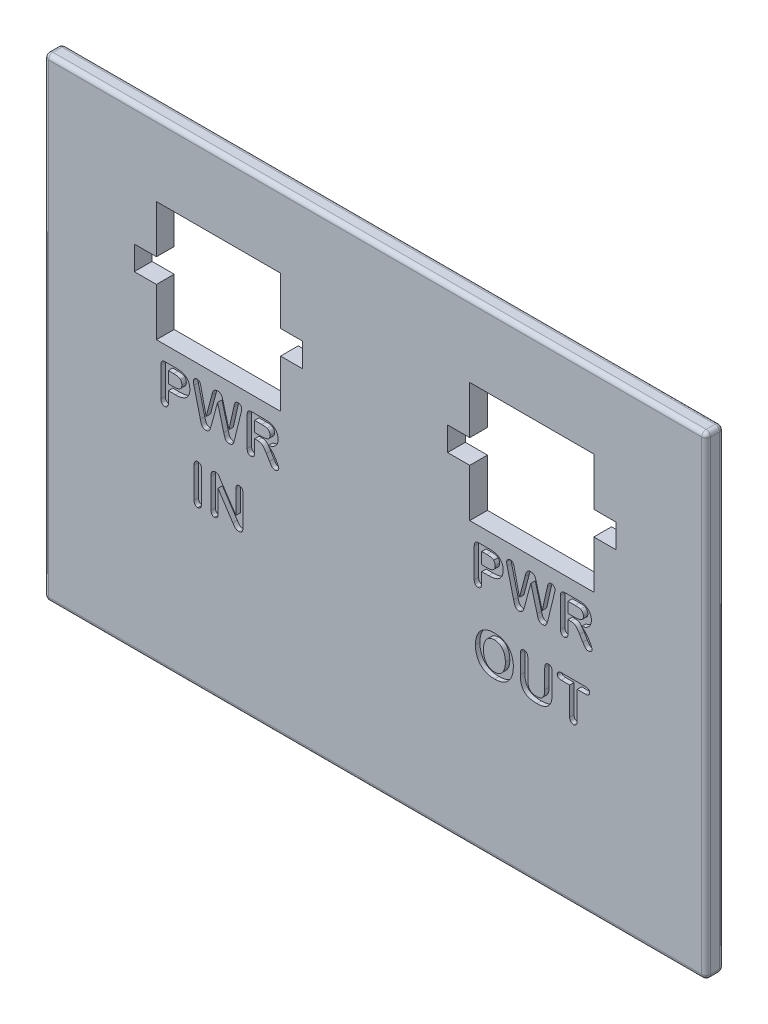
from build123d import *

# Parameters (mm, degrees)
SKETCH1_W           = 74.7
SKETCH1_H           = 53.5
BOSS_EXTRUDE1_DEPTH = 2
CUT_EXTRUDE1_DEPTH  = 46.984616993
FILLET1_R           = 0.5
CUT_EXTRUDE2_DEPTH  = 0.5


with BuildPart() as part:
    # Sketch1 → Boss-Extrude1 (new body)
    with BuildSketch(Plane.XY):
        Rectangle(SKETCH1_W, SKETCH1_H)
    extrude(amount=BOSS_EXTRUDE1_DEPTH)

    # Sketch5 → Cut-Extrude1 (cut, through all)
    with BuildSketch(Plane.XY.offset(2)):
        Polygon((24.675, 18.5), (10.675, 18.5), (10.675, 13.1), (8.175, 13.1), (8.175, 10.4), (10.675, 10.4), (10.675, 5), (24.675, 5), (24.675, 10.4), (27.175, 10.4), (27.175, 13.1), (24.675, 13.1), align=None)
        Polygon((-10.675, 18.5), (-24.675, 18.5), (-24.675, 13.1), (-27.175, 13.1), (-27.175, 10.4), (-24.675, 10.4), (-24.675, 5), (-10.675, 5), (-10.675, 10.4), (-8.175, 10.4), (-8.175, 13.1), (-10.675, 13.1), align=None)
    extrude(amount=-CUT_EXTRUDE1_DEPTH, mode=Mode.SUBTRACT)

    # Fillet1
    fillet1_edges = [part.edges().sort_by_distance(p)[0] for p in [
        (0, -26.75, 2),
        (0, -26.75, 0),
        (-37.35, 0, 2),
        (-37.35, -26.75, 1),
        (-37.35, 0, 0),
        (0, 26.75, 2),
        (-37.35, 26.75, 1),
        (0, 26.75, 0),
        (37.35, -26.75, 1),
        (37.35, 0, 2),
        (37.35, 26.75, 1),
        (37.35, 0, 0),
    ]]
    fillet(fillet1_edges, radius=FILLET1_R)

    # Sketch6 → Cut-Extrude2 (cut)
    # profile 1 of 11: a face of its own
    with BuildSketch(Plane.XY.offset(2)):
        with BuildLine():
            Line((-22.53046875, 0.6875), (-23.325, 0.6875))
            Line((-23.325, 0.6875), (-23.325, -0.526269531))
            add(Edge.make_bspline(
                [(-23.325, -0.526269531), (-23.326012223, -0.567125988), (-23.327931321, -0.644586786), (-23.35106835, -0.75263787), (-23.387497819, -0.846329867), (-23.440976253, -0.922387834), (-23.505001687, -0.982305609), (-23.577627084, -1.025891505), (-23.659125457, -1.051144773), (-23.715940252, -1.0545178), (-23.745117188, -1.05625)],
                knots=[0, 0, 0, 0, 1.285699921, 2.437591255, 3.464765735, 4.43309728, 5.341309432, 6.21076238, 7.081146562, 8, 8, 8, 8], degree=3))
            add(Edge.make_bspline(
                [(-23.745117188, -1.05625), (-23.775449781, -1.054515436), (-23.834250573, -1.051152922), (-23.918296543, -1.026342676), (-23.991758925, -0.982455871), (-24.056388387, -0.923850923), (-24.108043677, -0.847492543), (-24.14347535, -0.754612458), (-24.165589524, -0.647127064), (-24.167657857, -0.570334152), (-24.16875, -0.529785156)],
                knots=[0, 0, 0, 0, 0.952842406, 1.847118322, 2.721986042, 3.621319613, 4.568808427, 5.589565879, 6.727217387, 8, 8, 8, 8], degree=3))
            Line((-24.16875, -0.529785156), (-24.16875, 2.795996094))
            add(Edge.make_bspline(
                [(-24.16875, 2.795996094), (-24.1685055, 2.81915474), (-24.168034106, 2.863804423), (-24.161815948, 2.928460915), (-24.151391115, 2.987791917), (-24.137428436, 3.042336508), (-24.119205223, 3.09128044), (-24.096914943, 3.135295249), (-24.070661762, 3.174310593), (-24.02865181, 3.219562809), (-23.963177479, 3.266938173), (-23.866593714, 3.304889959), (-23.751711085, 3.32739686), (-23.669060376, 3.329904376), (-23.624707031, 3.33125)],
                knots=[0, 0, 0, 0, 0.941718592, 1.815625801, 2.638480297, 3.389986758, 4.102699286, 4.758224476, 5.39283612, 6.008479495, 7.262224214, 8.640906231, 10.197389428, 12, 12, 12, 12], degree=3))
            Line((-23.624707031, 3.33125), (-22.522558594, 3.33125))
            add(Edge.make_bspline(
                [(-22.522558594, 3.33125), (-22.483001983, 3.331257568), (-22.406205049, 3.331272261), (-22.294576282, 3.326349689), (-22.189974227, 3.32025313), (-22.092258793, 3.312951451), (-22.001676418, 3.30143274), (-21.918220989, 3.287162197), (-21.841442272, 3.272030796), (-21.793289347, 3.258589433), (-21.770214844, 3.252148437)],
                knots=[0, 0, 0, 0, 1.25088383, 2.428520539, 3.533027188, 4.564878591, 5.52680176, 6.419426011, 7.242601342, 8, 8, 8, 8], degree=3))
            add(Edge.make_bspline(
                [(-21.770214844, 3.252148437), (-21.72646996, 3.238831907), (-21.640413853, 3.212635273), (-21.519464415, 3.155913754), (-21.406453301, 3.089253227), (-21.303951339, 3.008925937), (-21.21150738, 2.918553937), (-21.130529418, 2.818049831), (-21.061647401, 2.707735279), (-21.00593065, 2.587550084), (-20.960401102, 2.459756632), (-20.929445773, 2.323444458), (-20.909299634, 2.179607484), (-20.907281859, 2.080930577), (-20.90625, 2.03046875)],
                knots=[0, 0, 0, 0, 1.016072159, 1.998844374, 2.963446839, 3.929479405, 4.88809646, 5.833686282, 6.79396355, 7.773575509, 8.775354313, 9.806098629, 10.878073131, 12, 12, 12, 12], degree=3))
            add(Edge.make_bspline(
                [(-20.90625, 2.03046875), (-20.907270042, 1.977081055), (-20.909255661, 1.873156328), (-20.929297, 1.722279867), (-20.960155602, 1.580980201), (-21.005265968, 1.449722719), (-21.063336537, 1.32872901), (-21.134322785, 1.217875441), (-21.217558717, 1.116684356), (-21.313909762, 1.025867153), (-21.422922321, 0.945607844), (-21.544151396, 0.875488974), (-21.678876697, 0.818300613), (-21.825044592, 0.769406351), (-21.984187171, 0.733486157), (-22.154952972, 0.705931944), (-22.338577756, 0.69035739), (-22.465108173, 0.688473264), (-22.53046875, 0.6875)],
                knots=[0, 0, 0, 0, 1.064269092, 2.071710987, 3.030014155, 3.944730477, 4.833317459, 5.700512996, 6.563900655, 7.440202656, 8.334248487, 9.258341999, 10.226640684, 11.248485432, 12.328534365, 13.476518405, 14.696469853, 16, 16, 16, 16], degree=3))
        make_face()
        with BuildLine():
            Line((-22.740527344, 2.65625), (-23.325, 2.65625))
            Line((-23.325, 2.65625), (-23.325, 1.3625))
            Line((-23.325, 1.3625), (-22.740527344, 1.3625))
            add(Edge.make_bspline(
                [(-22.740527344, 1.3625), (-22.69158541, 1.36345721), (-22.597663049, 1.36529415), (-22.46272606, 1.376011296), (-22.340602314, 1.396442182), (-22.230341874, 1.422780465), (-22.132363258, 1.45939774), (-22.046993192, 1.507490262), (-21.97292072, 1.564506048), (-21.912071402, 1.632810994), (-21.863169278, 1.711473231), (-21.830776901, 1.802305322), (-21.809834234, 1.903542747), (-21.807483301, 1.974688566), (-21.80625, 2.012011719)],
                knots=[0, 0, 0, 0, 1.355309994, 2.600917123, 3.743816141, 4.780660951, 5.735811607, 6.62931006, 7.484500426, 8.311764707, 9.149305958, 10.032284453, 10.967734859, 12, 12, 12, 12], degree=3))
            add(Edge.make_bspline(
                [(-21.80625, 2.012011719), (-21.808142381, 2.056758271), (-21.811789716, 2.143001814), (-21.843617743, 2.265767146), (-21.894696612, 2.376932211), (-21.946537999, 2.437828163), (-21.972363281, 2.468164063)],
                knots=[0, 0, 0, 0, 1.078100798, 2.07790835, 3.042491687, 4, 4, 4, 4], degree=3))
            add(Edge.make_bspline(
                [(-21.972363281, 2.468164063), (-21.989499714, 2.483387777), (-22.025525765, 2.515392708), (-22.091896982, 2.554023398), (-22.170987187, 2.584327779), (-22.260839026, 2.612414331), (-22.363559249, 2.631413504), (-22.478227167, 2.646533607), (-22.605341715, 2.655043513), (-22.694226703, 2.655836782), (-22.740527344, 2.65625)],
                knots=[0, 0, 0, 0, 0.67948794, 1.428492636, 2.263733299, 3.191206897, 4.220047442, 5.360670486, 6.625159889, 8, 8, 8, 8], degree=3))
        make_face(mode=Mode.SUBTRACT)
    # profile 2 of 11: a face of its own
    with BuildSketch(Plane.XY.offset(2)):
        with BuildLine():
            Line((-17.080371094, -0.295117188), (-17.779980469, 2.31875))
            Line((-17.779980469, 2.31875), (-18.488378906, -0.295117188))
            add(Edge.make_bspline(
                [(-18.488378906, -0.295117188), (-18.501599802, -0.341099964), (-18.526040379, -0.426105216), (-18.559321157, -0.543885907), (-18.591713561, -0.639776099), (-18.617748516, -0.71943474), (-18.647598875, -0.786580704), (-18.686840487, -0.846112269), (-18.733030666, -0.903624899), (-18.789223866, -0.955965345), (-18.854184807, -1.002436073), (-18.931592729, -1.033377638), (-19.017920969, -1.053430806), (-19.07887934, -1.055284202), (-19.110644531, -1.05625)],
                knots=[0, 0, 0, 0, 1.593450199, 2.945703666, 4.074932583, 4.963578588, 5.736316224, 6.513047046, 7.331315113, 8.187222847, 9.064061049, 9.973669067, 10.944086134, 12, 12, 12, 12], degree=3))
            add(Edge.make_bspline(
                [(-19.110644531, -1.05625), (-19.136470143, -1.055699758), (-19.18605701, -1.054643256), (-19.257006496, -1.043181029), (-19.320857289, -1.023878962), (-19.378031136, -0.997276214), (-19.428930291, -0.963380953), (-19.473594443, -0.922558628), (-19.51402354, -0.8761452), (-19.56152867, -0.803631876), (-19.610922735, -0.697703736), (-19.655731152, -0.558417801), (-19.691088008, -0.4151754), (-19.715814342, -0.320870943), (-19.727636719, -0.27578125)],
                knots=[0, 0, 0, 0, 0.844984364, 1.622425369, 2.344584211, 3.02258317, 3.679700754, 4.338496446, 4.99812959, 5.68983231, 7.169954297, 8.807945526, 10.473786272, 12, 12, 12, 12], degree=3))
            Line((-19.727636719, -0.27578125), (-20.447460938, 2.654492187))
            add(Edge.make_bspline(
                [(-20.447460938, 2.654492187), (-20.45721328, 2.694255402), (-20.475494353, 2.768792801), (-20.495366372, 2.87352958), (-20.50914775, 2.963222428), (-20.511451611, 3.018028744), (-20.5125, 3.04296875)],
                knots=[0, 0, 0, 0, 1.244637899, 2.333112935, 3.241471125, 4, 4, 4, 4], degree=3))
            add(Edge.make_bspline(
                [(-20.5125, 3.04296875), (-20.511429341, 3.070418808), (-20.509339132, 3.124008556), (-20.484723495, 3.199803574), (-20.448707615, 3.269796512), (-20.395882262, 3.329318414), (-20.334512699, 3.381064847), (-20.262702212, 3.416931793), (-20.184657861, 3.44033315), (-20.130058033, 3.442591545), (-20.102050781, 3.44375)],
                knots=[0, 0, 0, 0, 1.026200576, 2.003414008, 2.96246285, 3.960541354, 4.968440915, 5.956723063, 6.951891004, 8, 8, 8, 8], degree=3))
            add(Edge.make_bspline(
                [(-20.102050781, 3.44375), (-20.082993487, 3.443181946), (-20.046208039, 3.442085455), (-19.993315577, 3.435484121), (-19.94544356, 3.422747639), (-19.901963301, 3.406912953), (-19.864449816, 3.383761713), (-19.830475954, 3.357824313), (-19.802138558, 3.325716104), (-19.770741526, 3.274360364), (-19.736609037, 3.198848945), (-19.700646063, 3.094614869), (-19.664767835, 2.973747167), (-19.646136802, 2.88639014), (-19.636230469, 2.839941406)],
                knots=[0, 0, 0, 0, 0.808122328, 1.559882671, 2.252704358, 2.905404214, 3.512433654, 4.113718811, 4.711917797, 5.314868035, 6.65938252, 8.214937873, 9.987439056, 12, 12, 12, 12], degree=3))
            Line((-19.636230469, 2.839941406), (-19.069335938, 0.29375))
            Line((-19.069335938, 0.29375), (-18.434765625, 2.676464844))
            add(Edge.make_bspline(
                [(-18.434765625, 2.676464844), (-18.423509926, 2.719283965), (-18.402330181, 2.799856315), (-18.370089579, 2.912185978), (-18.339418126, 3.008069633), (-18.31023305, 3.090252024), (-18.277392302, 3.162395647), (-18.235573239, 3.227124994), (-18.184588476, 3.286308464), (-18.126109179, 3.341494576), (-18.056200364, 3.388315049), (-17.973663332, 3.420085896), (-17.88065731, 3.44131468), (-17.814683844, 3.442910544), (-17.779980469, 3.44375)],
                knots=[0, 0, 0, 0, 1.431879488, 2.694354579, 3.779085509, 4.687368261, 5.51393756, 6.336587382, 7.17007913, 8.035022418, 8.931165, 9.870736774, 10.879964543, 12, 12, 12, 12], degree=3))
            add(Edge.make_bspline(
                [(-17.779980469, 3.44375), (-17.745016636, 3.442458402), (-17.678542028, 3.440002766), (-17.584875167, 3.420139862), (-17.503500034, 3.385500526), (-17.435769446, 3.336978012), (-17.379145962, 3.281735709), (-17.332424204, 3.223076189), (-17.293236298, 3.163019081), (-17.264695139, 3.095891166), (-17.238795654, 3.017796093), (-17.208939581, 2.922839327), (-17.174633741, 2.806896541), (-17.151667844, 2.722220856), (-17.139257813, 2.676464844)],
                knots=[0, 0, 0, 0, 1.14054899, 2.168456379, 3.106445743, 4.005812281, 4.871449232, 5.680910185, 6.450289684, 7.203755686, 8.053559891, 9.136318933, 10.452559013, 12, 12, 12, 12], degree=3))
            Line((-17.139257813, 2.676464844), (-16.499414063, 0.29375))
            Line((-16.499414063, 0.29375), (-15.932519531, 2.839941406))
            add(Edge.make_bspline(
                [(-15.932519531, 2.839941406), (-15.925966583, 2.87133026), (-15.913561193, 2.930752522), (-15.893196159, 3.014174943), (-15.873972468, 3.086872296), (-15.855716347, 3.150774566), (-15.833525866, 3.207659242), (-15.805023177, 3.260294265), (-15.769596143, 3.309327406), (-15.728431315, 3.355787913), (-15.6783001, 3.396652566), (-15.615943834, 3.424432197), (-15.544360955, 3.441387984), (-15.493464204, 3.442935966), (-15.466699219, 3.44375)],
                knots=[0, 0, 0, 0, 1.365133971, 2.584336173, 3.655375053, 4.566954256, 5.412386126, 6.249588628, 7.10798716, 7.982279155, 8.888122676, 9.836835566, 10.862460541, 12, 12, 12, 12], degree=3))
            add(Edge.make_bspline(
                [(-15.466699219, 3.44375), (-15.4390192, 3.442483953), (-15.385141971, 3.44001968), (-15.307528445, 3.418174822), (-15.236957129, 3.381262643), (-15.174320553, 3.331259457), (-15.121116453, 3.271511597), (-15.08364825, 3.20158648), (-15.059501488, 3.124823336), (-15.057351323, 3.070694002), (-15.05625, 3.04296875)],
                knots=[0, 0, 0, 0, 1.03699291, 2.018434435, 2.996793341, 4.006213175, 5.011314616, 5.975429195, 6.96300709, 8, 8, 8, 8], degree=3))
            add(Edge.make_bspline(
                [(-15.05625, 3.04296875), (-15.057433923, 3.019802032), (-15.060126077, 2.967122647), (-15.072007322, 2.878921085), (-15.094191817, 2.772855273), (-15.111772778, 2.696060132), (-15.121289063, 2.654492187)],
                knots=[0, 0, 0, 0, 0.70532364, 1.603853198, 2.703005224, 4, 4, 4, 4], degree=3))
            Line((-15.121289063, 2.654492187), (-15.841113281, -0.27578125))
            add(Edge.make_bspline(
                [(-15.841113281, -0.27578125), (-15.852630563, -0.321830625), (-15.874098581, -0.407665874), (-15.906853569, -0.526188634), (-15.93528832, -0.625507074), (-15.962079082, -0.707690074), (-15.990558035, -0.778495095), (-16.028419141, -0.841408809), (-16.074039133, -0.900548648), (-16.12875395, -0.954360093), (-16.192760027, -1.001869674), (-16.271461316, -1.032788246), (-16.360610895, -1.053770083), (-16.424566894, -1.055396897), (-16.458105469, -1.05625)],
                knots=[0, 0, 0, 0, 1.552883699, 2.894548732, 4.02287014, 4.932163049, 5.722544985, 6.513217449, 7.326118303, 8.159774563, 9.018830479, 9.912428932, 10.905276121, 12, 12, 12, 12], degree=3))
            add(Edge.make_bspline(
                [(-16.458105469, -1.05625), (-16.489862519, -1.055272629), (-16.550805268, -1.053397023), (-16.637241185, -1.033496934), (-16.714348792, -1.001995379), (-16.780335261, -0.95756508), (-16.835302219, -0.905045011), (-16.88245643, -0.849514024), (-16.920790447, -0.790610823), (-16.950116847, -0.724318151), (-16.976568326, -0.645864142), (-17.007532465, -0.548927461), (-17.0421067, -0.429412059), (-17.066929054, -0.342294129), (-17.080371094, -0.295117188)],
                knots=[0, 0, 0, 0, 1.054963199, 2.024506573, 2.933295648, 3.811943645, 4.653302703, 5.455819296, 6.231850806, 6.982109028, 7.860757024, 8.985975481, 10.367816402, 12, 12, 12, 12], degree=3))
        make_face()
    # profile 3 of 11: a face of its own
    with BuildSketch(Plane.XY.offset(2)):
        with BuildLine():
            Line((-13.289648438, 0.85625), (-13.59375, 0.85625))
            Line((-13.59375, 0.85625), (-13.59375, -0.525390625))
            add(Edge.make_bspline(
                [(-13.59375, -0.525390625), (-13.594820667, -0.567979348), (-13.596823944, -0.647665191), (-13.618543959, -0.758638033), (-13.655096347, -0.852232384), (-13.706747986, -0.927949465), (-13.770757107, -0.985312018), (-13.843783561, -1.026842908), (-13.926087776, -1.052267836), (-13.984095165, -1.054899375), (-14.013867188, -1.05625)],
                knots=[0, 0, 0, 0, 1.331902197, 2.492062242, 3.520752585, 4.456973203, 5.333663409, 6.188000262, 7.069999586, 8, 8, 8, 8], degree=3))
            add(Edge.make_bspline(
                [(-14.013867188, -1.05625), (-14.045685431, -1.054635296), (-14.106923015, -1.051527626), (-14.19316213, -1.025741685), (-14.267641069, -0.982088853), (-14.330534071, -0.922013803), (-14.379338948, -0.844365033), (-14.412952148, -0.750844471), (-14.434194759, -0.642350403), (-14.436355004, -0.564758753), (-14.4375, -0.523632813)],
                knots=[0, 0, 0, 0, 0.98783513, 1.901193439, 2.76656523, 3.649069121, 4.578809423, 5.590416226, 6.722847106, 8, 8, 8, 8], degree=3))
            Line((-14.4375, -0.523632813), (-14.4375, 2.795996094))
            add(Edge.make_bspline(
                [(-14.4375, 2.795996094), (-14.436211925, 2.839775587), (-14.433795025, 2.92192198), (-14.410361008, 3.035569245), (-14.372256268, 3.131002205), (-14.315900252, 3.207772656), (-14.240046244, 3.265070648), (-14.14582525, 3.3041987), (-14.033156973, 3.327569977), (-13.951882357, 3.329967348), (-13.908398438, 3.33125)],
                knots=[0, 0, 0, 0, 1.204539147, 2.260157444, 3.178834964, 4.014831347, 4.849268471, 5.763683293, 6.803515522, 8, 8, 8, 8], degree=3))
            Line((-13.908398438, 3.33125), (-12.505664063, 3.33125))
            add(Edge.make_bspline(
                [(-12.505664063, 3.33125), (-12.459081165, 3.330823225), (-12.369409564, 3.330001687), (-12.239802983, 3.326256526), (-12.120839174, 3.31711247), (-12.011125485, 3.305925103), (-11.909218964, 3.29093788), (-11.813684353, 3.26732304), (-11.722662037, 3.239263847), (-11.665502918, 3.21375575), (-11.637304688, 3.201171875)],
                knots=[0, 0, 0, 0, 1.26312999, 2.431512321, 3.514756431, 4.497259456, 5.421894158, 6.30431173, 7.16346842, 8, 8, 8, 8], degree=3))
            add(Edge.make_bspline(
                [(-11.637304688, 3.201171875), (-11.603563121, 3.186025911), (-11.536471371, 3.155909667), (-11.441840584, 3.098678122), (-11.352973858, 3.033051636), (-11.271319374, 2.95778147), (-11.196244456, 2.876006528), (-11.132260516, 2.785310122), (-11.076384822, 2.689372414), (-11.030717552, 2.587038452), (-10.995139776, 2.480059653), (-10.968047924, 2.369681781), (-10.953301704, 2.255871015), (-10.951106208, 2.179042378), (-10.95, 2.140332031)],
                knots=[0, 0, 0, 0, 0.991101386, 1.970706541, 2.959125982, 3.949043219, 4.94477413, 5.930285116, 6.919453739, 7.918248778, 8.929482208, 9.939493973, 10.961807665, 12, 12, 12, 12], degree=3))
            add(Edge.make_bspline(
                [(-10.95, 2.140332031), (-10.950782461, 2.101032893), (-10.952311144, 2.024254745), (-10.966017663, 1.912305592), (-10.986891833, 1.806095384), (-11.016163783, 1.705588473), (-11.056676523, 1.611902695), (-11.103679279, 1.523824887), (-11.159837069, 1.441789534), (-11.225038537, 1.366105285), (-11.299508789, 1.296664369), (-11.382089692, 1.23192345), (-11.473346372, 1.172168323), (-11.574242264, 1.118792681), (-11.683718264, 1.070120624), (-11.802454445, 1.027989151), (-11.929342447, 0.988215826), (-12.017992903, 0.96839459), (-12.063574219, 0.958203125)],
                knots=[0, 0, 0, 0, 1.055142993, 2.061417327, 3.024364171, 3.960444909, 4.866579139, 5.760848635, 6.638237999, 7.530982974, 8.438346324, 9.368654669, 10.346405169, 11.363786046, 12.431180916, 13.561267985, 14.746079633, 16, 16, 16, 16], degree=3))
            add(Edge.make_bspline(
                [(-12.063574219, 0.958203125), (-12.02405796, 0.936217104), (-11.943482271, 0.891386472), (-11.830090862, 0.805799241), (-11.718042156, 0.707731691), (-11.611716746, 0.594089826), (-11.508409436, 0.472926798), (-11.408631993, 0.347347826), (-11.315576852, 0.217258745), (-11.22981389, 0.084666607), (-11.150477939, -0.045650431), (-11.079878538, -0.171298536), (-11.019354084, -0.290867532), (-10.967923446, -0.401912613), (-10.926956092, -0.501021397), (-10.897769138, -0.584905081), (-10.878160155, -0.651404169), (-10.874278619, -0.690840843), (-10.87265625, -0.707324219)],
                knots=[0, 0, 0, 0, 1.03513849, 2.110700756, 3.247524223, 4.444168505, 5.672631725, 6.896242247, 8.11841533, 9.33624741, 10.514118669, 11.614189172, 12.638032039, 13.584270828, 14.418327787, 15.09350525, 15.621111712, 16, 16, 16, 16], degree=3))
            add(Edge.make_bspline(
                [(-10.87265625, -0.707324219), (-10.875656029, -0.735891106), (-10.88195036, -0.795832014), (-10.918431408, -0.864879246), (-10.957029097, -0.916110228), (-10.991704918, -0.952204134), (-11.032467128, -0.982514705), (-11.077366628, -1.00915452), (-11.126660568, -1.030335655), (-11.180214396, -1.044979128), (-11.237298391, -1.055317137), (-11.276904254, -1.055934259), (-11.297167969, -1.05625)],
                knots=[0, 0, 0, 0, 1.406975553, 2.952207972, 3.767564478, 4.575194754, 5.410805362, 6.266190622, 7.146975177, 8.048514508, 9.001553276, 10, 10, 10, 10], degree=3))
            add(Edge.make_bspline(
                [(-11.297167969, -1.05625), (-11.320977117, -1.055509909), (-11.366938039, -1.054081244), (-11.432770571, -1.040163336), (-11.493382069, -1.019698985), (-11.565200739, -0.978610581), (-11.644381697, -0.911366728), (-11.711472078, -0.828428224), (-11.763216764, -0.750038846), (-11.80831298, -0.677973716), (-11.861738187, -0.5945029), (-11.898201478, -0.533982743), (-11.917675781, -0.501660156)],
                knots=[0, 0, 0, 0, 0.811939239, 1.567358733, 2.288822191, 2.987519458, 4.379962622, 5.808282274, 6.615771143, 7.58722562, 8.711386222, 10, 10, 10, 10], degree=3))
            Line((-11.917675781, -0.501660156), (-12.270996094, 0.079296875))
            add(Edge.make_bspline(
                [(-12.270996094, 0.079296875), (-12.301120634, 0.129605171), (-12.358088042, 0.224741336), (-12.443976782, 0.356244864), (-12.525776868, 0.468123382), (-12.602662925, 0.562864634), (-12.67737586, 0.641892545), (-12.751919309, 0.706955473), (-12.828246276, 0.75730986), (-12.905852759, 0.796851995), (-12.989241454, 0.824193012), (-13.080592846, 0.843313519), (-13.181843807, 0.854634747), (-13.25270436, 0.855696461), (-13.289648438, 0.85625)],
                knots=[0, 0, 0, 0, 1.54923933, 2.929709427, 4.148172657, 5.209662816, 6.151357592, 7.018659628, 7.817301611, 8.561575462, 9.313059885, 10.128334294, 11.024182546, 12, 12, 12, 12], degree=3))
        make_face()
        with BuildLine():
            Line((-12.7921875, 2.65625), (-13.59375, 2.65625))
            Line((-13.59375, 2.65625), (-13.59375, 1.475))
            Line((-13.59375, 1.475), (-12.815917969, 1.475))
            add(Edge.make_bspline(
                [(-12.815917969, 1.475), (-12.765806411, 1.47571825), (-12.669293563, 1.477101572), (-12.531030209, 1.486329694), (-12.405026204, 1.502916164), (-12.291693366, 1.526095612), (-12.189735427, 1.556802169), (-12.101595757, 1.599720667), (-12.02400195, 1.64938908), (-11.960535519, 1.711292843), (-11.909508461, 1.784185672), (-11.874955475, 1.870131334), (-11.853430375, 1.967597063), (-11.851180652, 2.036497431), (-11.85, 2.07265625)],
                knots=[0, 0, 0, 0, 1.392051732, 2.681035748, 3.846991481, 4.919597892, 5.892539963, 6.795281946, 7.634960986, 8.440706374, 9.24212453, 10.088520951, 10.996858383, 12, 12, 12, 12], degree=3))
            add(Edge.make_bspline(
                [(-11.85, 2.07265625), (-11.850803494, 2.101763209), (-11.852377628, 2.158786978), (-11.87087267, 2.240992886), (-11.899114809, 2.318127509), (-11.938864235, 2.389030937), (-11.987977941, 2.453945939), (-12.047680308, 2.509173545), (-12.115239713, 2.557283365), (-12.165951641, 2.580310015), (-12.191894531, 2.592089844)],
                knots=[0, 0, 0, 0, 1.054557985, 2.06599635, 3.041648879, 4.026871944, 5.005128146, 5.982979788, 6.968145478, 8, 8, 8, 8], degree=3))
            add(Edge.make_bspline(
                [(-12.191894531, 2.592089844), (-12.206172923, 2.597308674), (-12.237210615, 2.608653119), (-12.289581174, 2.621636479), (-12.351139634, 2.631325745), (-12.421357623, 2.641479399), (-12.500872394, 2.64827342), (-12.589726627, 2.651978009), (-12.687854872, 2.656146198), (-12.756439852, 2.656214434), (-12.7921875, 2.65625)],
                knots=[0, 0, 0, 0, 0.601274756, 1.307022564, 2.130372336, 3.066540635, 4.11402688, 5.286356465, 6.585603249, 8, 8, 8, 8], degree=3))
        make_face(mode=Mode.SUBTRACT)
    # profile 4 of 11: a face of its own
    with BuildSketch(Plane.XY.offset(2)):
        with BuildLine():
            Line((-20.43125, -8.550488281), (-20.43125, -5.121875))
            add(Edge.make_bspline(
                [(-20.43125, -5.121875), (-20.430220808, -5.079849243), (-20.428289676, -5.00099394), (-20.405840203, -4.891030598), (-20.371106741, -4.79652597), (-20.31850182, -4.720351881), (-20.255838337, -4.660102879), (-20.182317997, -4.618163118), (-20.100874321, -4.591200122), (-20.043284104, -4.588753749), (-20.013769531, -4.5875)],
                knots=[0, 0, 0, 0, 1.314663, 2.466776515, 3.501452278, 4.446007437, 5.34208644, 6.201692853, 7.078380494, 8, 8, 8, 8], degree=3))
            add(Edge.make_bspline(
                [(-20.013769531, -4.5875), (-19.983377855, -4.58872861), (-19.924351067, -4.591114819), (-19.840890462, -4.61813822), (-19.766042513, -4.659833937), (-19.701729817, -4.719398367), (-19.648881402, -4.795418318), (-19.612329992, -4.889541625), (-19.590618604, -5.000179585), (-19.588583946, -5.079576842), (-19.5875, -5.121875)],
                knots=[0, 0, 0, 0, 0.939704012, 1.825095485, 2.692007845, 3.579728686, 4.520135675, 5.539530793, 6.689207656, 8, 8, 8, 8], degree=3))
            Line((-19.5875, -5.121875), (-19.5875, -8.550488281))
            add(Edge.make_bspline(
                [(-19.5875, -8.550488281), (-19.588575288, -8.592787345), (-19.590593696, -8.672186302), (-19.612464399, -8.783081218), (-19.648925164, -8.877703772), (-19.701395427, -8.954736446), (-19.766349529, -9.014018565), (-19.840439191, -9.057358245), (-19.924610505, -9.082446733), (-19.983428212, -9.085780345), (-20.013769531, -9.0875)],
                knots=[0, 0, 0, 0, 1.307751878, 2.454761992, 3.480206064, 4.425894871, 5.311556588, 6.180961951, 7.061642901, 8, 8, 8, 8], degree=3))
            add(Edge.make_bspline(
                [(-20.013769531, -9.0875), (-20.042937572, -9.08575298), (-20.099735049, -9.082351094), (-20.181114526, -9.057380169), (-20.253090871, -9.013224805), (-20.317020956, -8.95388996), (-20.370367509, -8.876864072), (-20.404525803, -8.781453106), (-20.428661208, -8.671509147), (-20.430350419, -8.592541921), (-20.43125, -8.550488281)],
                knots=[0, 0, 0, 0, 0.912572231, 1.777006537, 2.632638816, 3.534642503, 4.491136576, 5.533474522, 6.686463005, 8, 8, 8, 8], degree=3))
        make_face()
    # profile 5 of 11: a face of its own
    with BuildSketch(Plane.XY.offset(2)):
        with BuildLine():
            Line((-17.416601563, -5.115722656), (-15.70625, -7.68125))
            Line((-15.70625, -7.68125), (-15.70625, -5.091992188))
            add(Edge.make_bspline(
                [(-15.70625, -5.091992188), (-15.70492962, -5.052359164), (-15.702456489, -4.978124745), (-15.683668096, -4.87404108), (-15.650746847, -4.785748869), (-15.604095069, -4.713243212), (-15.546092782, -4.656534344), (-15.477607199, -4.616247807), (-15.399985329, -4.591558976), (-15.345206336, -4.588883028), (-15.316894531, -4.5875)],
                knots=[0, 0, 0, 0, 1.319117216, 2.470765316, 3.505116792, 4.43580569, 5.318756254, 6.18027265, 7.059497782, 8, 8, 8, 8], degree=3))
            add(Edge.make_bspline(
                [(-15.316894531, -4.5875), (-15.287721306, -4.588908998), (-15.2312539, -4.591636242), (-15.151398563, -4.61582252), (-15.081604722, -4.656527207), (-15.022684578, -4.713159993), (-14.975182383, -4.785668138), (-14.94110514, -4.873852412), (-14.922618507, -4.978150288), (-14.920096483, -5.052368054), (-14.91875, -5.091992188)],
                knots=[0, 0, 0, 0, 0.959871134, 1.857917088, 2.719075999, 3.600089629, 4.526699118, 5.554128738, 6.694173474, 8, 8, 8, 8], degree=3))
            Line((-14.91875, -5.091992188), (-14.91875, -8.514453125))
            add(Edge.make_bspline(
                [(-14.91875, -8.514453125), (-14.91983574, -8.559377153), (-14.921873547, -8.643694354), (-14.943584085, -8.761591878), (-14.980197373, -8.86194448), (-15.031424925, -8.945207856), (-15.098847834, -9.010532825), (-15.182199284, -9.055433867), (-15.27938116, -9.08347767), (-15.348914404, -9.086114521), (-15.385449219, -9.0875)],
                knots=[0, 0, 0, 0, 1.276164049, 2.395212213, 3.391561633, 4.297456637, 5.151673506, 6.027862746, 6.963780962, 8, 8, 8, 8], degree=3))
            add(Edge.make_bspline(
                [(-15.385449219, -9.0875), (-15.422489822, -9.085762065), (-15.493931233, -9.082410052), (-15.596850002, -9.057937367), (-15.690426122, -9.012280954), (-15.774506085, -8.946264611), (-15.853218291, -8.86619795), (-15.925266795, -8.773328203), (-15.993146785, -8.672712147), (-16.039605113, -8.604950836), (-16.063085938, -8.570703125)],
                knots=[0, 0, 0, 0, 0.990229924, 1.909888509, 2.806876858, 3.75171819, 4.754420985, 5.802993103, 6.889595585, 8, 8, 8, 8], degree=3))
            Line((-16.063085938, -8.570703125), (-17.73125, -6.05))
            Line((-17.73125, -6.05), (-17.73125, -8.585644531))
            add(Edge.make_bspline(
                [(-17.73125, -8.585644531), (-17.732567323, -8.624394913), (-17.735062669, -8.697798001), (-17.754330283, -8.801015374), (-17.789775726, -8.889145849), (-17.838475128, -8.961621051), (-17.898278071, -9.018011587), (-17.966645754, -9.058608801), (-18.043364971, -9.083367484), (-18.097275039, -9.086096511), (-18.125, -9.0875)],
                knots=[0, 0, 0, 0, 1.293064309, 2.449392962, 3.484384031, 4.441729672, 5.340986808, 6.204611779, 7.076664708, 8, 8, 8, 8], degree=3))
            add(Edge.make_bspline(
                [(-18.125, -9.0875), (-18.153314098, -9.08614904), (-18.208466343, -9.083517543), (-18.286535108, -9.058083534), (-18.355197535, -9.016109311), (-18.415159609, -8.959400424), (-18.461815791, -8.885558177), (-18.495140241, -8.79742357), (-18.515155403, -8.694926198), (-18.517504833, -8.621776311), (-18.51875, -8.583007813)],
                knots=[0, 0, 0, 0, 0.938889884, 1.828837584, 2.693878765, 3.596100726, 4.546832571, 5.570326044, 6.712304089, 8, 8, 8, 8], degree=3))
            Line((-18.51875, -8.583007813), (-18.51875, -5.225585938))
            add(Edge.make_bspline(
                [(-18.51875, -5.225585938), (-18.518420262, -5.19186248), (-18.517796758, -5.128094598), (-18.508574601, -5.038305035), (-18.495972534, -4.95928163), (-18.480350789, -4.91196605), (-18.473046875, -4.88984375)],
                knots=[0, 0, 0, 0, 1.18793306, 2.246269525, 3.180047019, 4, 4, 4, 4], degree=3))
            add(Edge.make_bspline(
                [(-18.473046875, -4.88984375), (-18.463245977, -4.868317808), (-18.443679031, -4.825342463), (-18.400773306, -4.768398463), (-18.351802623, -4.715326528), (-18.292703606, -4.671603281), (-18.228937327, -4.634442903), (-18.161309731, -4.606978248), (-18.090629168, -4.590490862), (-18.042761375, -4.588501806), (-18.018652344, -4.5875)],
                knots=[0, 0, 0, 0, 0.980600708, 1.957714689, 2.948627098, 3.97434472, 5.000279326, 6.011426356, 6.998437519, 8, 8, 8, 8], degree=3))
            add(Edge.make_bspline(
                [(-18.018652344, -4.5875), (-17.982626443, -4.58893327), (-17.915071298, -4.591620912), (-17.821921113, -4.622733012), (-17.742622753, -4.668340571), (-17.674049028, -4.730593188), (-17.609210783, -4.807529309), (-17.549117579, -4.902379583), (-17.484043661, -5.006580689), (-17.439425173, -5.078787066), (-17.416601563, -5.115722656)],
                knots=[0, 0, 0, 0, 1.01695463, 1.906975685, 2.751376853, 3.592506721, 4.517315556, 5.594915983, 6.76973195, 8, 8, 8, 8], degree=3))
        make_face()
    # profile 6 of 11: a face of its own
    with BuildSketch(Plane.XY.offset(2)):
        with BuildLine():
            Line((12.81953125, 0.6875), (12.025, 0.6875))
            Line((12.025, 0.6875), (12.025, -0.526269531))
            add(Edge.make_bspline(
                [(12.025, -0.526269531), (12.023987777, -0.567125988), (12.022068679, -0.644586786), (11.99893165, -0.75263787), (11.962502181, -0.846329867), (11.909023747, -0.922387834), (11.844998313, -0.982305609), (11.772372916, -1.025891505), (11.690874543, -1.051144773), (11.634059748, -1.0545178), (11.604882813, -1.05625)],
                knots=[0, 0, 0, 0, 1.285699921, 2.437591255, 3.464765735, 4.43309728, 5.341309432, 6.21076238, 7.081146562, 8, 8, 8, 8], degree=3))
            add(Edge.make_bspline(
                [(11.604882813, -1.05625), (11.574550219, -1.054515436), (11.515749427, -1.051152922), (11.431703457, -1.026342676), (11.358241075, -0.982455871), (11.293611613, -0.923850923), (11.241956323, -0.847492543), (11.20652465, -0.754612458), (11.184410476, -0.647127064), (11.182342143, -0.570334152), (11.18125, -0.529785156)],
                knots=[0, 0, 0, 0, 0.952842406, 1.847118322, 2.721986042, 3.621319613, 4.568808427, 5.589565879, 6.727217387, 8, 8, 8, 8], degree=3))
            Line((11.18125, -0.529785156), (11.18125, 2.795996094))
            add(Edge.make_bspline(
                [(11.18125, 2.795996094), (11.1814945, 2.81915474), (11.181965894, 2.863804423), (11.188184052, 2.928460915), (11.198608885, 2.987791917), (11.212571564, 3.042336508), (11.230794777, 3.09128044), (11.253085057, 3.135295249), (11.279338238, 3.174310593), (11.32134819, 3.219562809), (11.386822521, 3.266938173), (11.483406286, 3.304889959), (11.598288915, 3.32739686), (11.680939624, 3.329904376), (11.725292969, 3.33125)],
                knots=[0, 0, 0, 0, 0.941718592, 1.815625801, 2.638480297, 3.389986758, 4.102699286, 4.758224476, 5.39283612, 6.008479495, 7.262224214, 8.640906231, 10.197389428, 12, 12, 12, 12], degree=3))
            Line((11.725292969, 3.33125), (12.827441406, 3.33125))
            add(Edge.make_bspline(
                [(12.827441406, 3.33125), (12.866998017, 3.331257568), (12.943794951, 3.331272261), (13.055423718, 3.326349689), (13.160025773, 3.32025313), (13.257741207, 3.312951451), (13.348323582, 3.30143274), (13.431779011, 3.287162197), (13.508557728, 3.272030796), (13.556710653, 3.258589433), (13.579785156, 3.252148437)],
                knots=[0, 0, 0, 0, 1.25088383, 2.428520539, 3.533027188, 4.564878591, 5.52680176, 6.419426011, 7.242601342, 8, 8, 8, 8], degree=3))
            add(Edge.make_bspline(
                [(13.579785156, 3.252148437), (13.62353004, 3.238831907), (13.709586147, 3.212635273), (13.830535585, 3.155913754), (13.943546699, 3.089253227), (14.046048661, 3.008925937), (14.13849262, 2.918553937), (14.219470582, 2.818049831), (14.288352599, 2.707735279), (14.34406935, 2.587550084), (14.389598898, 2.459756632), (14.420554227, 2.323444458), (14.440700366, 2.179607484), (14.442718141, 2.080930577), (14.44375, 2.03046875)],
                knots=[0, 0, 0, 0, 1.016072159, 1.998844374, 2.963446839, 3.929479405, 4.88809646, 5.833686282, 6.79396355, 7.773575509, 8.775354313, 9.806098629, 10.878073131, 12, 12, 12, 12], degree=3))
            add(Edge.make_bspline(
                [(14.44375, 2.03046875), (14.442729958, 1.977081055), (14.440744339, 1.873156328), (14.420703, 1.722279867), (14.389844398, 1.580980201), (14.344734032, 1.449722719), (14.286663463, 1.32872901), (14.215677215, 1.217875441), (14.132441283, 1.116684356), (14.036090238, 1.025867153), (13.927077679, 0.945607844), (13.805848604, 0.875488974), (13.671123303, 0.818300613), (13.524955408, 0.769406351), (13.365812829, 0.733486157), (13.195047028, 0.705931944), (13.011422244, 0.69035739), (12.884891827, 0.688473264), (12.81953125, 0.6875)],
                knots=[0, 0, 0, 0, 1.064269092, 2.071710987, 3.030014155, 3.944730477, 4.833317459, 5.700512996, 6.563900655, 7.440202656, 8.334248487, 9.258341999, 10.226640684, 11.248485432, 12.328534365, 13.476518405, 14.696469853, 16, 16, 16, 16], degree=3))
        make_face()
        with BuildLine():
            Line((12.609472656, 2.65625), (12.025, 2.65625))
            Line((12.025, 2.65625), (12.025, 1.3625))
            Line((12.025, 1.3625), (12.609472656, 1.3625))
            add(Edge.make_bspline(
                [(12.609472656, 1.3625), (12.65841459, 1.36345721), (12.752336951, 1.36529415), (12.88727394, 1.376011296), (13.009397686, 1.396442182), (13.119658126, 1.422780465), (13.217636742, 1.45939774), (13.303006808, 1.507490262), (13.37707928, 1.564506048), (13.437928598, 1.632810994), (13.486830722, 1.711473231), (13.519223099, 1.802305322), (13.540165766, 1.903542747), (13.542516699, 1.974688566), (13.54375, 2.012011719)],
                knots=[0, 0, 0, 0, 1.355309994, 2.600917123, 3.743816141, 4.780660951, 5.735811607, 6.62931006, 7.484500426, 8.311764707, 9.149305958, 10.032284453, 10.967734859, 12, 12, 12, 12], degree=3))
            add(Edge.make_bspline(
                [(13.54375, 2.012011719), (13.541857619, 2.056758271), (13.538210284, 2.143001814), (13.506382257, 2.265767146), (13.455303388, 2.376932211), (13.403462001, 2.437828163), (13.377636719, 2.468164063)],
                knots=[0, 0, 0, 0, 1.078100798, 2.07790835, 3.042491687, 4, 4, 4, 4], degree=3))
            add(Edge.make_bspline(
                [(13.377636719, 2.468164063), (13.360500286, 2.483387777), (13.324474235, 2.515392708), (13.258103018, 2.554023398), (13.179012813, 2.584327779), (13.089160974, 2.612414331), (12.986440751, 2.631413504), (12.871772833, 2.646533607), (12.744658285, 2.655043513), (12.655773297, 2.655836782), (12.609472656, 2.65625)],
                knots=[0, 0, 0, 0, 0.67948794, 1.428492636, 2.263733299, 3.191206897, 4.220047442, 5.360670486, 6.625159889, 8, 8, 8, 8], degree=3))
        make_face(mode=Mode.SUBTRACT)
    # profile 7 of 11: a face of its own
    with BuildSketch(Plane.XY.offset(2)):
        with BuildLine():
            Line((18.269628906, -0.295117188), (17.570019531, 2.31875))
            Line((17.570019531, 2.31875), (16.861621094, -0.295117188))
            add(Edge.make_bspline(
                [(16.861621094, -0.295117188), (16.848400198, -0.341099964), (16.823959621, -0.426105216), (16.790678843, -0.543885907), (16.758286439, -0.639776099), (16.732251484, -0.71943474), (16.702401125, -0.786580704), (16.663159513, -0.846112269), (16.616969334, -0.903624899), (16.560776134, -0.955965345), (16.495815193, -1.002436073), (16.418407271, -1.033377638), (16.332079031, -1.053430806), (16.27112066, -1.055284202), (16.239355469, -1.05625)],
                knots=[0, 0, 0, 0, 1.593450199, 2.945703666, 4.074932583, 4.963578588, 5.736316224, 6.513047046, 7.331315113, 8.187222847, 9.064061049, 9.973669067, 10.944086134, 12, 12, 12, 12], degree=3))
            add(Edge.make_bspline(
                [(16.239355469, -1.05625), (16.213529857, -1.055699758), (16.16394299, -1.054643256), (16.092993504, -1.043181029), (16.029142711, -1.023878962), (15.971968864, -0.997276214), (15.921069709, -0.963380953), (15.876405557, -0.922558628), (15.83597646, -0.8761452), (15.78847133, -0.803631876), (15.739077265, -0.697703736), (15.694268848, -0.558417801), (15.658911992, -0.4151754), (15.634185658, -0.320870943), (15.622363281, -0.27578125)],
                knots=[0, 0, 0, 0, 0.844984364, 1.622425369, 2.344584211, 3.02258317, 3.679700754, 4.338496446, 4.99812959, 5.68983231, 7.169954297, 8.807945526, 10.473786272, 12, 12, 12, 12], degree=3))
            Line((15.622363281, -0.27578125), (14.902539063, 2.654492187))
            add(Edge.make_bspline(
                [(14.902539063, 2.654492187), (14.89278672, 2.694255402), (14.874505647, 2.768792801), (14.854633628, 2.87352958), (14.84085225, 2.963222428), (14.838548389, 3.018028744), (14.8375, 3.04296875)],
                knots=[0, 0, 0, 0, 1.244637899, 2.333112935, 3.241471125, 4, 4, 4, 4], degree=3))
            add(Edge.make_bspline(
                [(14.8375, 3.04296875), (14.838570659, 3.070418808), (14.840660868, 3.124008556), (14.865276505, 3.199803574), (14.901292385, 3.269796512), (14.954117738, 3.329318414), (15.015487301, 3.381064847), (15.087297788, 3.416931793), (15.165342139, 3.44033315), (15.219941967, 3.442591545), (15.247949219, 3.44375)],
                knots=[0, 0, 0, 0, 1.026200576, 2.003414008, 2.96246285, 3.960541354, 4.968440915, 5.956723063, 6.951891004, 8, 8, 8, 8], degree=3))
            add(Edge.make_bspline(
                [(15.247949219, 3.44375), (15.267006513, 3.443181946), (15.303791961, 3.442085455), (15.356684423, 3.435484121), (15.40455644, 3.422747639), (15.448036699, 3.406912953), (15.485550184, 3.383761713), (15.519524046, 3.357824313), (15.547861442, 3.325716104), (15.579258474, 3.274360364), (15.613390963, 3.198848945), (15.649353937, 3.094614869), (15.685232165, 2.973747167), (15.703863198, 2.88639014), (15.713769531, 2.839941406)],
                knots=[0, 0, 0, 0, 0.808122328, 1.559882671, 2.252704358, 2.905404214, 3.512433654, 4.113718811, 4.711917797, 5.314868035, 6.65938252, 8.214937873, 9.987439056, 12, 12, 12, 12], degree=3))
            Line((15.713769531, 2.839941406), (16.280664063, 0.29375))
            Line((16.280664063, 0.29375), (16.915234375, 2.676464844))
            add(Edge.make_bspline(
                [(16.915234375, 2.676464844), (16.926490074, 2.719283965), (16.947669819, 2.799856315), (16.979910421, 2.912185978), (17.010581874, 3.008069633), (17.03976695, 3.090252024), (17.072607698, 3.162395647), (17.114426761, 3.227124994), (17.165411524, 3.286308464), (17.223890821, 3.341494576), (17.293799636, 3.388315049), (17.376336668, 3.420085896), (17.46934269, 3.44131468), (17.535316156, 3.442910544), (17.570019531, 3.44375)],
                knots=[0, 0, 0, 0, 1.431879488, 2.694354579, 3.779085509, 4.687368261, 5.51393756, 6.336587382, 7.17007913, 8.035022418, 8.931165, 9.870736774, 10.879964543, 12, 12, 12, 12], degree=3))
            add(Edge.make_bspline(
                [(17.570019531, 3.44375), (17.604983364, 3.442458402), (17.671457972, 3.440002766), (17.765124833, 3.420139862), (17.846499966, 3.385500526), (17.914230554, 3.336978012), (17.970854038, 3.281735709), (18.017575796, 3.223076189), (18.056763702, 3.163019081), (18.085304861, 3.095891166), (18.111204346, 3.017796093), (18.141060419, 2.922839327), (18.175366259, 2.806896541), (18.198332156, 2.722220856), (18.210742188, 2.676464844)],
                knots=[0, 0, 0, 0, 1.14054899, 2.168456379, 3.106445743, 4.005812281, 4.871449232, 5.680910185, 6.450289684, 7.203755686, 8.053559891, 9.136318933, 10.452559013, 12, 12, 12, 12], degree=3))
            Line((18.210742188, 2.676464844), (18.850585938, 0.29375))
            Line((18.850585938, 0.29375), (19.417480469, 2.839941406))
            add(Edge.make_bspline(
                [(19.417480469, 2.839941406), (19.424033417, 2.87133026), (19.436438807, 2.930752522), (19.456803841, 3.014174943), (19.476027532, 3.086872296), (19.494283653, 3.150774566), (19.516474134, 3.207659242), (19.544976823, 3.260294265), (19.580403857, 3.309327406), (19.621568685, 3.355787913), (19.6716999, 3.396652566), (19.734056166, 3.424432197), (19.805639045, 3.441387984), (19.856535796, 3.442935966), (19.883300781, 3.44375)],
                knots=[0, 0, 0, 0, 1.365133971, 2.584336173, 3.655375053, 4.566954256, 5.412386126, 6.249588628, 7.10798716, 7.982279155, 8.888122676, 9.836835566, 10.862460541, 12, 12, 12, 12], degree=3))
            add(Edge.make_bspline(
                [(19.883300781, 3.44375), (19.9109808, 3.442483953), (19.964858029, 3.44001968), (20.042471555, 3.418174822), (20.113042871, 3.381262643), (20.175679447, 3.331259457), (20.228883547, 3.271511597), (20.26635175, 3.20158648), (20.290498512, 3.124823336), (20.292648677, 3.070694002), (20.29375, 3.04296875)],
                knots=[0, 0, 0, 0, 1.03699291, 2.018434435, 2.996793341, 4.006213175, 5.011314616, 5.975429195, 6.96300709, 8, 8, 8, 8], degree=3))
            add(Edge.make_bspline(
                [(20.29375, 3.04296875), (20.292566077, 3.019802032), (20.289873923, 2.967122647), (20.277992678, 2.878921085), (20.255808183, 2.772855273), (20.238227222, 2.696060132), (20.228710938, 2.654492187)],
                knots=[0, 0, 0, 0, 0.70532364, 1.603853198, 2.703005224, 4, 4, 4, 4], degree=3))
            Line((20.228710938, 2.654492187), (19.508886719, -0.27578125))
            add(Edge.make_bspline(
                [(19.508886719, -0.27578125), (19.497369437, -0.321830625), (19.475901419, -0.407665874), (19.443146431, -0.526188634), (19.41471168, -0.625507074), (19.387920918, -0.707690074), (19.359441965, -0.778495095), (19.321580859, -0.841408809), (19.275960867, -0.900548648), (19.22124605, -0.954360093), (19.157239973, -1.001869674), (19.078538684, -1.032788246), (18.989389105, -1.053770083), (18.925433106, -1.055396897), (18.891894531, -1.05625)],
                knots=[0, 0, 0, 0, 1.552883699, 2.894548732, 4.02287014, 4.932163049, 5.722544985, 6.513217449, 7.326118303, 8.159774563, 9.018830479, 9.912428932, 10.905276121, 12, 12, 12, 12], degree=3))
            add(Edge.make_bspline(
                [(18.891894531, -1.05625), (18.860137481, -1.055272629), (18.799194732, -1.053397023), (18.712758815, -1.033496934), (18.635651208, -1.001995379), (18.569664739, -0.95756508), (18.514697781, -0.905045011), (18.46754357, -0.849514024), (18.429209553, -0.790610823), (18.399883153, -0.724318151), (18.373431674, -0.645864142), (18.342467535, -0.548927461), (18.3078933, -0.429412059), (18.283070946, -0.342294129), (18.269628906, -0.295117188)],
                knots=[0, 0, 0, 0, 1.054963199, 2.024506573, 2.933295648, 3.811943645, 4.653302703, 5.455819296, 6.231850806, 6.982109028, 7.860757024, 8.985975481, 10.367816402, 12, 12, 12, 12], degree=3))
        make_face()
    # profile 8 of 11: a face of its own
    with BuildSketch(Plane.XY.offset(2)):
        with BuildLine():
            Line((22.060351563, 0.85625), (21.75625, 0.85625))
            Line((21.75625, 0.85625), (21.75625, -0.525390625))
            add(Edge.make_bspline(
                [(21.75625, -0.525390625), (21.755179333, -0.567979348), (21.753176056, -0.647665191), (21.731456041, -0.758638033), (21.694903653, -0.852232384), (21.643252014, -0.927949465), (21.579242893, -0.985312018), (21.506216439, -1.026842908), (21.423912224, -1.052267836), (21.365904835, -1.054899375), (21.336132813, -1.05625)],
                knots=[0, 0, 0, 0, 1.331902197, 2.492062242, 3.520752585, 4.456973203, 5.333663409, 6.188000262, 7.069999586, 8, 8, 8, 8], degree=3))
            add(Edge.make_bspline(
                [(21.336132813, -1.05625), (21.304314569, -1.054635296), (21.243076985, -1.051527626), (21.15683787, -1.025741685), (21.082358931, -0.982088853), (21.019465929, -0.922013803), (20.970661052, -0.844365033), (20.937047852, -0.750844471), (20.915805241, -0.642350403), (20.913644996, -0.564758753), (20.9125, -0.523632813)],
                knots=[0, 0, 0, 0, 0.98783513, 1.901193439, 2.76656523, 3.649069121, 4.578809423, 5.590416226, 6.722847106, 8, 8, 8, 8], degree=3))
            Line((20.9125, -0.523632813), (20.9125, 2.795996094))
            add(Edge.make_bspline(
                [(20.9125, 2.795996094), (20.913788075, 2.839775587), (20.916204975, 2.92192198), (20.939638992, 3.035569245), (20.977743732, 3.131002205), (21.034099748, 3.207772656), (21.109953756, 3.265070648), (21.20417475, 3.3041987), (21.316843027, 3.327569977), (21.398117643, 3.329967348), (21.441601563, 3.33125)],
                knots=[0, 0, 0, 0, 1.204539147, 2.260157444, 3.178834964, 4.014831347, 4.849268471, 5.763683293, 6.803515522, 8, 8, 8, 8], degree=3))
            Line((21.441601563, 3.33125), (22.844335938, 3.33125))
            add(Edge.make_bspline(
                [(22.844335938, 3.33125), (22.890918835, 3.330823225), (22.980590436, 3.330001687), (23.110197017, 3.326256526), (23.229160826, 3.31711247), (23.338874515, 3.305925103), (23.440781036, 3.29093788), (23.536315647, 3.26732304), (23.627337963, 3.239263847), (23.684497082, 3.21375575), (23.712695313, 3.201171875)],
                knots=[0, 0, 0, 0, 1.26312999, 2.431512321, 3.514756431, 4.497259456, 5.421894158, 6.30431173, 7.16346842, 8, 8, 8, 8], degree=3))
            add(Edge.make_bspline(
                [(23.712695313, 3.201171875), (23.746436879, 3.186025911), (23.813528629, 3.155909667), (23.908159416, 3.098678122), (23.997026142, 3.033051636), (24.078680626, 2.95778147), (24.153755544, 2.876006528), (24.217739484, 2.785310122), (24.273615178, 2.689372414), (24.319282448, 2.587038452), (24.354860224, 2.480059653), (24.381952076, 2.369681781), (24.396698296, 2.255871015), (24.398893792, 2.179042378), (24.4, 2.140332031)],
                knots=[0, 0, 0, 0, 0.991101386, 1.970706541, 2.959125982, 3.949043219, 4.94477413, 5.930285116, 6.919453739, 7.918248778, 8.929482208, 9.939493973, 10.961807665, 12, 12, 12, 12], degree=3))
            add(Edge.make_bspline(
                [(24.4, 2.140332031), (24.399217539, 2.101032893), (24.397688856, 2.024254745), (24.383982337, 1.912305592), (24.363108167, 1.806095384), (24.333836217, 1.705588473), (24.293323477, 1.611902695), (24.246320721, 1.523824887), (24.190162931, 1.441789534), (24.124961463, 1.366105285), (24.050491211, 1.296664369), (23.967910308, 1.23192345), (23.876653628, 1.172168323), (23.775757736, 1.118792681), (23.666281736, 1.070120624), (23.547545555, 1.027989151), (23.420657553, 0.988215826), (23.332007097, 0.96839459), (23.286425781, 0.958203125)],
                knots=[0, 0, 0, 0, 1.055142993, 2.061417327, 3.024364171, 3.960444909, 4.866579139, 5.760848635, 6.638237999, 7.530982974, 8.438346324, 9.368654669, 10.346405169, 11.363786046, 12.431180916, 13.561267985, 14.746079633, 16, 16, 16, 16], degree=3))
            add(Edge.make_bspline(
                [(23.286425781, 0.958203125), (23.32594204, 0.936217104), (23.406517729, 0.891386472), (23.519909138, 0.805799241), (23.631957844, 0.707731691), (23.738283254, 0.594089826), (23.841590564, 0.472926798), (23.941368007, 0.347347826), (24.034423148, 0.217258745), (24.12018611, 0.084666607), (24.199522061, -0.045650431), (24.270121462, -0.171298536), (24.330645916, -0.290867532), (24.382076554, -0.401912613), (24.423043908, -0.501021397), (24.452230862, -0.584905081), (24.471839845, -0.651404169), (24.475721381, -0.690840843), (24.47734375, -0.707324219)],
                knots=[0, 0, 0, 0, 1.03513849, 2.110700756, 3.247524223, 4.444168505, 5.672631725, 6.896242247, 8.11841533, 9.33624741, 10.514118669, 11.614189172, 12.638032039, 13.584270828, 14.418327787, 15.09350525, 15.621111712, 16, 16, 16, 16], degree=3))
            add(Edge.make_bspline(
                [(24.47734375, -0.707324219), (24.474343971, -0.735891106), (24.46804964, -0.795832014), (24.431568592, -0.864879246), (24.392970903, -0.916110228), (24.358295082, -0.952204134), (24.317532872, -0.982514705), (24.272633372, -1.00915452), (24.223339432, -1.030335655), (24.169785604, -1.044979128), (24.112701609, -1.055317137), (24.073095746, -1.055934259), (24.052832031, -1.05625)],
                knots=[0, 0, 0, 0, 1.406975553, 2.952207972, 3.767564478, 4.575194754, 5.410805362, 6.266190622, 7.146975177, 8.048514508, 9.001553276, 10, 10, 10, 10], degree=3))
            add(Edge.make_bspline(
                [(24.052832031, -1.05625), (24.029022883, -1.055509909), (23.983061961, -1.054081244), (23.917229429, -1.040163336), (23.856617931, -1.019698985), (23.784799261, -0.978610581), (23.705618303, -0.911366728), (23.638527922, -0.828428224), (23.586783236, -0.750038846), (23.54168702, -0.677973716), (23.488261813, -0.5945029), (23.451798522, -0.533982743), (23.432324219, -0.501660156)],
                knots=[0, 0, 0, 0, 0.811939239, 1.567358733, 2.288822191, 2.987519458, 4.379962622, 5.808282274, 6.615771143, 7.58722562, 8.711386222, 10, 10, 10, 10], degree=3))
            Line((23.432324219, -0.501660156), (23.079003906, 0.079296875))
            add(Edge.make_bspline(
                [(23.079003906, 0.079296875), (23.048879366, 0.129605171), (22.991911958, 0.224741336), (22.906023218, 0.356244864), (22.824223132, 0.468123382), (22.747337075, 0.562864634), (22.67262414, 0.641892545), (22.598080691, 0.706955473), (22.521753724, 0.75730986), (22.444147241, 0.796851995), (22.360758546, 0.824193012), (22.269407154, 0.843313519), (22.168156193, 0.854634747), (22.09729564, 0.855696461), (22.060351563, 0.85625)],
                knots=[0, 0, 0, 0, 1.54923933, 2.929709427, 4.148172657, 5.209662816, 6.151357592, 7.018659628, 7.817301611, 8.561575462, 9.313059885, 10.128334294, 11.024182546, 12, 12, 12, 12], degree=3))
        make_face()
        with BuildLine():
            Line((22.5578125, 2.65625), (21.75625, 2.65625))
            Line((21.75625, 2.65625), (21.75625, 1.475))
            Line((21.75625, 1.475), (22.534082031, 1.475))
            add(Edge.make_bspline(
                [(22.534082031, 1.475), (22.584193589, 1.47571825), (22.680706437, 1.477101572), (22.818969791, 1.486329694), (22.944973796, 1.502916164), (23.058306634, 1.526095612), (23.160264573, 1.556802169), (23.248404243, 1.599720667), (23.32599805, 1.64938908), (23.389464481, 1.711292843), (23.440491539, 1.784185672), (23.475044525, 1.870131334), (23.496569625, 1.967597063), (23.498819348, 2.036497431), (23.5, 2.07265625)],
                knots=[0, 0, 0, 0, 1.392051732, 2.681035748, 3.846991481, 4.919597892, 5.892539963, 6.795281946, 7.634960986, 8.440706374, 9.24212453, 10.088520951, 10.996858383, 12, 12, 12, 12], degree=3))
            add(Edge.make_bspline(
                [(23.5, 2.07265625), (23.499196506, 2.101763209), (23.497622372, 2.158786978), (23.47912733, 2.240992886), (23.450885191, 2.318127509), (23.411135765, 2.389030937), (23.362022059, 2.453945939), (23.302319692, 2.509173545), (23.234760287, 2.557283365), (23.184048359, 2.580310015), (23.158105469, 2.592089844)],
                knots=[0, 0, 0, 0, 1.054557985, 2.06599635, 3.041648879, 4.026871944, 5.005128146, 5.982979788, 6.968145478, 8, 8, 8, 8], degree=3))
            add(Edge.make_bspline(
                [(23.158105469, 2.592089844), (23.143827077, 2.597308674), (23.112789385, 2.608653119), (23.060418826, 2.621636479), (22.998860366, 2.631325745), (22.928642377, 2.641479399), (22.849127606, 2.64827342), (22.760273373, 2.651978009), (22.662145128, 2.656146198), (22.593560148, 2.656214434), (22.5578125, 2.65625)],
                knots=[0, 0, 0, 0, 0.601274756, 1.307022564, 2.130372336, 3.066540635, 4.11402688, 5.286356465, 6.585603249, 8, 8, 8, 8], degree=3))
        make_face(mode=Mode.SUBTRACT)
    # profile 9 of 11: a face of its own
    with BuildSketch(Plane.XY.offset(2)):
        with BuildLine():
            add(Edge.make_bspline(
                [(13.441308594, -4.5875), (13.497002887, -4.588281838), (13.606208811, -4.589814874), (13.766949783, -4.60371143), (13.921976772, -4.624338169), (14.071184822, -4.654028065), (14.214203786, -4.69276907), (14.351060899, -4.740382438), (14.481932515, -4.796710461), (14.606971692, -4.860648005), (14.724804869, -4.933025092), (14.83618228, -5.012173181), (14.939842377, -5.099253418), (15.036026795, -5.193501417), (15.124121861, -5.295174334), (15.205408294, -5.40370764), (15.27925993, -5.519711854), (15.344881366, -5.643162326), (15.403837791, -5.772214459), (15.455015913, -5.907246487), (15.497731202, -6.04768634), (15.533261109, -6.193766653), (15.560189184, -6.345273624), (15.579156897, -6.502562081), (15.592288301, -6.665011631), (15.593258035, -6.775363805), (15.59375, -6.831347656)],
                knots=[0, 0, 0, 0, 1.137132438, 2.22970057, 3.292424762, 4.329649132, 5.333981859, 6.315987487, 7.286185149, 8.241436353, 9.181332131, 10.107725602, 11.0292572, 11.943085262, 12.854854597, 13.773819033, 14.709898734, 15.660115542, 16.626635295, 17.605574315, 18.606712189, 19.622473761, 20.67399022, 21.747038223, 22.857027702, 24, 24, 24, 24], degree=3))
            add(Edge.make_bspline(
                [(15.59375, -6.831347656), (15.592033122, -6.913441225), (15.588664408, -7.074518399), (15.563111617, -7.310332461), (15.519794621, -7.534806994), (15.460800092, -7.747850943), (15.383259547, -7.947989387), (15.288923088, -8.134959494), (15.176862625, -8.307858781), (15.048285441, -8.466530948), (14.903683181, -8.61007718), (14.742067937, -8.735216443), (14.564441927, -8.842023057), (14.372382973, -8.931988395), (14.164740732, -9.002870665), (13.941935635, -9.050525171), (13.705343841, -9.082959392), (13.542498665, -9.085959573), (13.458886719, -9.0875)],
                knots=[0, 0, 0, 0, 1.119700056, 2.196982321, 3.230778928, 4.235358115, 5.208318876, 6.153781848, 7.087131445, 8.013361148, 8.934611457, 9.860297843, 10.794468433, 11.756326826, 12.748403726, 13.780058436, 14.860183413, 16, 16, 16, 16], degree=3))
            add(Edge.make_bspline(
                [(13.458886719, -9.0875), (13.375877189, -9.085501478), (13.21337097, -9.081589008), (12.976475455, -9.050237422), (12.752484404, -8.999803922), (12.542676686, -8.927693435), (12.348517839, -8.835863915), (12.169193752, -8.728974753), (12.008183527, -8.602704061), (11.863419015, -8.460656149), (11.734911752, -8.302606983), (11.625660415, -8.127773205), (11.52930965, -7.939960009), (11.453150836, -7.736381596), (11.392558363, -7.521454541), (11.34985391, -7.296780909), (11.323816301, -7.063701673), (11.320456598, -6.905536882), (11.31875, -6.825195313)],
                knots=[0, 0, 0, 0, 1.130091603, 2.212359386, 3.247930852, 4.252250901, 5.226719473, 6.16821431, 7.089197795, 8.00610207, 8.925165125, 9.855999165, 10.808795857, 11.79501972, 12.810514548, 13.846493258, 14.906102224, 16, 16, 16, 16], degree=3))
            add(Edge.make_bspline(
                [(11.31875, -6.825195313), (11.320298062, -6.743376013), (11.323342105, -6.582489997), (11.351446424, -6.346775845), (11.395819273, -6.121105121), (11.459065492, -5.906613924), (11.539256258, -5.704809063), (11.636590994, -5.517891341), (11.749284165, -5.346440134), (11.878081508, -5.190781746), (12.023187553, -5.051863859), (12.183790503, -4.930373563), (12.359099809, -4.825866169), (12.549123526, -4.739907185), (12.752997118, -4.670913757), (12.970667562, -4.622202318), (13.201725624, -4.592692212), (13.360066264, -4.589260674), (13.441308594, -4.5875)],
                knots=[0, 0, 0, 0, 1.125218611, 2.212582392, 3.260701818, 4.286054269, 5.284468473, 6.243521648, 7.180287843, 8.101949555, 9.017004541, 9.937572836, 10.866572707, 11.818894766, 12.801573564, 13.82236102, 14.882684417, 16, 16, 16, 16], degree=3))
        make_face()
        with BuildLine():
            add(Edge.make_bspline(
                [(14.69375, -6.825195313), (14.69203126, -6.746875687), (14.688703381, -6.595230741), (14.659209149, -6.375865163), (14.611437602, -6.172392778), (14.554499879, -6.01484373), (14.49982558, -5.898060947), (14.455173186, -5.816779783), (14.407140354, -5.740257438), (14.35262415, -5.671043355), (14.296074141, -5.605835787), (14.23484866, -5.546172394), (14.168841052, -5.492941547), (14.076342308, -5.428332464), (13.951777466, -5.361386102), (13.790944527, -5.30402009), (13.6195026, -5.268668879), (13.501538427, -5.26458509), (13.441308594, -5.2625)],
                knots=[0, 0, 0, 0, 1.663767962, 3.22144036, 4.693807908, 6.09809827, 6.772124886, 7.43249818, 8.068074837, 8.689496673, 9.30272399, 9.901527182, 10.503429657, 11.102750509, 12.297797107, 13.495176895, 14.721094103, 16, 16, 16, 16], degree=3))
            add(Edge.make_bspline(
                [(13.441308594, -5.2625), (13.398165102, -5.263573204), (13.312896106, -5.265694288), (13.187724296, -5.285838018), (13.067484939, -5.317340654), (12.952737455, -5.361402185), (12.844503764, -5.417671019), (12.743268059, -5.485985158), (12.650251095, -5.566078657), (12.564932217, -5.657627189), (12.487821289, -5.761553236), (12.419409539, -5.878934827), (12.359802536, -6.009773542), (12.308985279, -6.152901936), (12.2687938, -6.307584019), (12.240215623, -6.472198026), (12.222262855, -6.645795764), (12.219938367, -6.764506088), (12.21875, -6.825195313)],
                knots=[0, 0, 0, 0, 0.926902171, 1.831933723, 2.71800685, 3.595261319, 4.468550136, 5.334998465, 6.214894287, 7.1017058, 8.020008637, 8.99111482, 10.01694856, 11.106630737, 12.25237115, 13.448355624, 14.695502513, 16, 16, 16, 16], degree=3))
            add(Edge.make_bspline(
                [(12.21875, -6.825195313), (12.219941647, -6.886469376), (12.222273002, -7.006346778), (12.240189129, -7.181706134), (12.268953861, -7.348318514), (12.308858328, -7.505494343), (12.360483396, -7.651401228), (12.422456438, -7.784702223), (12.491930986, -7.906348149), (12.573890613, -8.012947111), (12.6624207, -8.1070155), (12.757564406, -8.188948451), (12.858635189, -8.258746692), (12.966600903, -8.315569177), (13.08086966, -8.35820377), (13.200178286, -8.390515287), (13.325301324, -8.408970711), (13.410488827, -8.411313839), (13.453613281, -8.4125)],
                knots=[0, 0, 0, 0, 1.300369924, 2.54406124, 3.737115199, 4.88637188, 5.981883645, 7.016846829, 8.003376514, 8.948590554, 9.863559023, 10.741055788, 11.608647785, 12.46534091, 13.323432129, 14.192248925, 15.0848625, 16, 16, 16, 16], degree=3))
            add(Edge.make_bspline(
                [(13.453613281, -8.4125), (13.509156609, -8.41063969), (13.618595819, -8.406974249), (13.778843761, -8.372750238), (13.931949689, -8.318940917), (14.053176389, -8.256984207), (14.144541951, -8.195953019), (14.210565946, -8.144463699), (14.271945046, -8.085871313), (14.330450521, -8.022437652), (14.384663511, -7.952779548), (14.435992123, -7.877780391), (14.483382558, -7.796638392), (14.527226946, -7.709807216), (14.566821452, -7.617444824), (14.601357021, -7.519796503), (14.62888807, -7.416432978), (14.652916421, -7.308314186), (14.671195942, -7.194728959), (14.684194481, -7.076221358), (14.692338904, -6.952457997), (14.693272334, -6.868274629), (14.69375, -6.825195313)],
                knots=[0, 0, 0, 0, 1.468568495, 2.893578421, 4.316075305, 5.755382189, 6.482330971, 7.222315454, 7.968369796, 8.725783183, 9.504530818, 10.302500265, 11.129737207, 11.9897977, 12.875655565, 13.787998707, 14.728608307, 15.705132475, 16.718642732, 17.771954593, 18.859838044, 20, 20, 20, 20], degree=3))
        make_face(mode=Mode.SUBTRACT)
    # profile 10 of 11: a face of its own
    with BuildSketch(Plane.XY.offset(2)):
        with BuildLine():
            Line((16.38125, -7.214550781), (16.38125, -5.121875))
            add(Edge.make_bspline(
                [(16.38125, -5.121875), (16.382286877, -5.079854483), (16.384232428, -5.001009012), (16.406587158, -4.890981065), (16.441569463, -4.796840244), (16.493023574, -4.720090962), (16.555836705, -4.660139555), (16.629288319, -4.618153039), (16.711032326, -4.591111189), (16.768920465, -4.588727501), (16.798730469, -4.5875)],
                knots=[0, 0, 0, 0, 1.314006093, 2.465543923, 3.499702682, 4.438645347, 5.334276599, 6.193453487, 7.069703068, 8, 8, 8, 8], degree=3))
            add(Edge.make_bspline(
                [(16.798730469, -4.5875), (16.829954519, -4.589176749), (16.889942409, -4.592398131), (16.975294104, -4.617506574), (17.049855309, -4.660734601), (17.113547776, -4.721013397), (17.164391717, -4.798503453), (17.200002342, -4.893223859), (17.221819294, -5.003993319), (17.223899427, -5.083385295), (17.225, -5.125390625)],
                knots=[0, 0, 0, 0, 0.96282878, 1.849794185, 2.716851436, 3.599658085, 4.532680285, 5.552030856, 6.704809248, 8, 8, 8, 8], degree=3))
            Line((17.225, -5.125390625), (17.225, -7.279589844))
            add(Edge.make_bspline(
                [(17.225, -7.279589844), (17.225998406, -7.338508644), (17.227909317, -7.451276911), (17.24268288, -7.613200254), (17.26764168, -7.76001902), (17.302878073, -7.892641132), (17.352210616, -8.011112093), (17.417796432, -8.115448576), (17.50001854, -8.205442452), (17.581049628, -8.268363346), (17.65401183, -8.309996405), (17.714707016, -8.337344924), (17.780324858, -8.361358162), (17.851816336, -8.378976383), (17.927675504, -8.394448159), (18.00908453, -8.404369573), (18.095557324, -8.412051927), (18.155156614, -8.41234836), (18.185644531, -8.4125)],
                knots=[0, 0, 0, 0, 1.640841622, 3.140506311, 4.523579023, 5.784571649, 6.954579444, 8.084197464, 9.198982671, 10.333306227, 10.925380769, 11.535182691, 12.185613052, 12.868404783, 13.583722754, 14.340779317, 15.151228418, 16, 16, 16, 16], degree=3))
            add(Edge.make_bspline(
                [(18.185644531, -8.4125), (18.227583537, -8.411756881), (18.308460829, -8.410323814), (18.424776183, -8.396598293), (18.531970117, -8.376539384), (18.629021408, -8.345364025), (18.717196001, -8.306776408), (18.795704684, -8.259432724), (18.864888358, -8.203126026), (18.924211036, -8.137450251), (18.974275448, -8.06219338), (19.018569513, -7.979332636), (19.05507807, -7.887141986), (19.085971641, -7.786706645), (19.109514431, -7.677011353), (19.125830216, -7.558617552), (19.135438375, -7.431213481), (19.136796717, -7.343474077), (19.1375, -7.298046875)],
                knots=[0, 0, 0, 0, 1.187087794, 2.289239917, 3.312641325, 4.270309596, 5.169103343, 6.032749862, 6.858132282, 7.686303516, 8.528484611, 9.411791075, 10.342302716, 11.33164497, 12.384483705, 13.515514569, 14.713654137, 16, 16, 16, 16], degree=3))
            Line((19.1375, -7.298046875), (19.1375, -5.125390625))
            add(Edge.make_bspline(
                [(19.1375, -5.125390625), (19.138683246, -5.082818534), (19.140903585, -5.002932779), (19.161372355, -4.891370561), (19.197148299, -4.797108601), (19.247448306, -4.720201335), (19.309653171, -4.659601157), (19.383650259, -4.618421848), (19.466056666, -4.590877133), (19.524566209, -4.588655068), (19.554980469, -4.5875)],
                knots=[0, 0, 0, 0, 1.324209478, 2.484855026, 3.512713035, 4.440887327, 5.324452051, 6.186293477, 7.057204391, 8, 8, 8, 8], degree=3))
            add(Edge.make_bspline(
                [(19.554980469, -4.5875), (19.585372258, -4.588728564), (19.644399267, -4.591114683), (19.727858303, -4.618138726), (19.802712064, -4.659832063), (19.867002183, -4.719405739), (19.920099518, -4.795612983), (19.956366305, -4.890471917), (19.978084546, -5.001648209), (19.980152364, -5.081334084), (19.98125, -5.123632813)],
                knots=[0, 0, 0, 0, 0.937671153, 1.821147261, 2.686184232, 3.571984669, 4.510357278, 5.535961965, 6.692043289, 8, 8, 8, 8], degree=3))
            Line((19.98125, -5.123632813), (19.98125, -7.22421875))
            add(Edge.make_bspline(
                [(19.98125, -7.22421875), (19.980066549, -7.305985693), (19.977794241, -7.462983875), (19.960759449, -7.687934296), (19.930973583, -7.891724129), (19.890714654, -8.076888115), (19.832306662, -8.246698429), (19.751988125, -8.403823721), (19.65104396, -8.55097884), (19.568527923, -8.63766623), (19.526855469, -8.681445313)],
                knots=[0, 0, 0, 0, 1.248457049, 2.397123805, 3.441600438, 4.391152342, 5.286682789, 6.174943873, 7.078305605, 8, 8, 8, 8], degree=3))
            add(Edge.make_bspline(
                [(19.526855469, -8.681445313), (19.486864865, -8.715230321), (19.406977265, -8.782721255), (19.2738539, -8.86658534), (19.132183263, -8.937833101), (18.980016658, -8.994077456), (18.816474445, -9.036176982), (18.640596428, -9.065415288), (18.451776992, -9.084287764), (18.321336499, -9.086408476), (18.254199219, -9.0875)],
                knots=[0, 0, 0, 0, 0.917673777, 1.83319953, 2.752815171, 3.696261941, 4.673826777, 5.7116717, 6.822205161, 8, 8, 8, 8], degree=3))
            add(Edge.make_bspline(
                [(18.254199219, -9.0875), (18.174463081, -9.086199115), (18.020578769, -9.083688512), (17.798306348, -9.063158311), (17.592956234, -9.030792094), (17.404654418, -8.983287016), (17.232417298, -8.922624081), (17.077985617, -8.844210986), (16.937898015, -8.754038475), (16.815634521, -8.646294756), (16.709066471, -8.523578213), (16.617535302, -8.385219508), (16.543667767, -8.229963991), (16.48208862, -8.059704667), (16.437914153, -7.872228914), (16.404134347, -7.668518769), (16.385458345, -7.447220427), (16.382686616, -7.293977964), (16.38125, -7.214550781)],
                knots=[0, 0, 0, 0, 1.244583114, 2.401944964, 3.48169555, 4.486712429, 5.430003149, 6.325898902, 7.184706889, 8.024138875, 8.860562605, 9.715550095, 10.605366032, 11.538500779, 12.536866304, 13.60758979, 14.759988597, 16, 16, 16, 16], degree=3))
        make_face()
    # profile 11 of 11: a face of its own
    with BuildSketch(Plane.XY.offset(2)):
        with BuildLine():
            Line((23.754394531, -5.43125), (22.79375, -5.43125))
            Line((22.79375, -5.43125), (22.79375, -8.556640625))
            add(Edge.make_bspline(
                [(22.79375, -8.556640625), (22.792708634, -8.598948679), (22.790760978, -8.67807699), (22.768599592, -8.78858472), (22.732706247, -8.882473175), (22.68043421, -8.958272405), (22.61707115, -9.016642621), (22.543902047, -9.057844135), (22.462052874, -9.083652496), (22.404298202, -9.08619086), (22.374511719, -9.0875)],
                knots=[0, 0, 0, 0, 1.324771526, 2.4777063, 3.516495944, 4.454151167, 5.338361256, 6.19400724, 7.068574513, 8, 8, 8, 8], degree=3))
            add(Edge.make_bspline(
                [(22.374511719, -9.0875), (22.344392759, -9.0863049), (22.285900233, -9.083983955), (22.203442238, -9.056460257), (22.128264369, -9.016232402), (22.06435358, -8.956371587), (22.011102121, -8.880692362), (21.976388252, -8.786250354), (21.952715432, -8.677052446), (21.950941572, -8.598393225), (21.95, -8.556640625)],
                knots=[0, 0, 0, 0, 0.936591527, 1.818907611, 2.686883908, 3.580272073, 4.52668274, 5.549195867, 6.699104295, 8, 8, 8, 8], degree=3))
            Line((21.95, -8.556640625), (21.95, -5.43125))
            Line((21.95, -5.43125), (20.988476563, -5.43125))
            add(Edge.make_bspline(
                [(20.988476563, -5.43125), (20.95319691, -5.430374593), (20.887005057, -5.42873215), (20.795135085, -5.40883309), (20.716291488, -5.378943898), (20.652495712, -5.333981715), (20.60367849, -5.278688073), (20.568023028, -5.215323538), (20.547732294, -5.14360122), (20.545103587, -5.093289541), (20.54375, -5.067382813)],
                knots=[0, 0, 0, 0, 1.298175259, 2.435642608, 3.448405227, 4.386245553, 5.281324188, 6.14672195, 7.045701294, 8, 8, 8, 8], degree=3))
            add(Edge.make_bspline(
                [(20.54375, -5.067382813), (20.544876873, -5.040248701), (20.547049829, -4.987925866), (20.570003624, -4.914601216), (20.605727047, -4.849757743), (20.657095223, -4.795690319), (20.721624157, -4.751758128), (20.799736819, -4.721502717), (20.890049794, -4.702921879), (20.954391685, -4.701011837), (20.988476563, -4.7)],
                knots=[0, 0, 0, 0, 0.993926626, 1.916593339, 2.793690024, 3.692250099, 4.629614642, 5.63892321, 6.749228366, 8, 8, 8, 8], degree=3))
            Line((20.988476563, -4.7), (23.754394531, -4.7))
            add(Edge.make_bspline(
                [(23.754394531, -4.7), (23.790252045, -4.700907456), (23.857588885, -4.702611568), (23.951099258, -4.722129149), (24.030979449, -4.75293172), (24.09442891, -4.799380501), (24.144938931, -4.854063423), (24.1795965, -4.91860683), (24.201720255, -4.990363015), (24.204062684, -5.041138167), (24.205273438, -5.067382813)],
                knots=[0, 0, 0, 0, 1.304496451, 2.449714448, 3.464685333, 4.39788137, 5.28974218, 6.154486031, 7.046091257, 8, 8, 8, 8], degree=3))
            add(Edge.make_bspline(
                [(24.205273438, -5.067382813), (24.203999313, -5.093308884), (24.201520859, -5.14374082), (24.180042679, -5.21541273), (24.143543642, -5.278742554), (24.093827035, -5.334018725), (24.029163684, -5.378940776), (23.949208132, -5.408966041), (23.85641517, -5.42857369), (23.789665488, -5.430324736), (23.754394531, -5.43125)],
                knots=[0, 0, 0, 0, 0.94771637, 1.843517728, 2.708217129, 3.604275273, 4.544436114, 5.560171289, 6.710778986, 8, 8, 8, 8], degree=3))
        make_face()
    extrude(amount=-CUT_EXTRUDE2_DEPTH, mode=Mode.SUBTRACT)


solid = part.part
